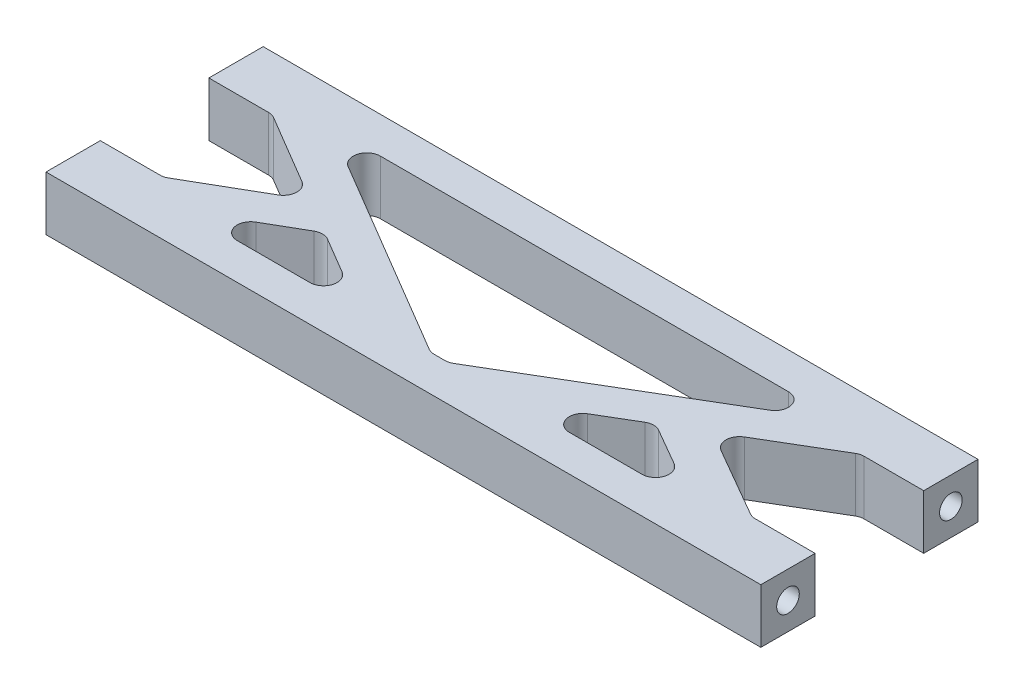
from build123d import *

# Parameters (mm, degrees)
SKETCH1_W                   = 79
SKETCH1_H                   = 24
BOSS_EXTRUDE1_DEPTH         = 6
CUT_EXTRUDE1_REACH          = 84.783
TAP_DRILL_FOR_M3_TAP1_D     = 2.5
TAP_DRILL_FOR_M3_TAP1_DEPTH = 10
TAP_DRILL_FOR_M3_TAP1_TIP   = 0.751075774
TAP_DRILL_FOR_M3_TAP2_D     = 2.5
TAP_DRILL_FOR_M3_TAP2_DEPTH = 10
TAP_DRILL_FOR_M3_TAP2_TIP   = 0.751075774
FILLET1_R                   = 1.5


with BuildPart() as part:
    # Sketch1 → Boss-Extrude1 (new body)
    with BuildSketch(Plane(origin=(0, 0, 0), x_dir=(1, 0, 0), z_dir=(0, 1, 0))):
        with Locations((39.5, 12)):
            Rectangle(SKETCH1_W, SKETCH1_H)
    extrude(amount=BOSS_EXTRUDE1_DEPTH)

    # Sketch2 → Cut-Extrude1 (cut, up to next)
    with BuildSketch(Plane(origin=(0, 6, 0), x_dir=(1, 0, 0), z_dir=(0, 1, 0)), mode=Mode.PRIVATE) as cut_extrude1_sk1:
        Polygon((0, 18), (7, 18), (17.261996282, 11.924766316), (7, 6), (0, 6), align=None)
    cut_extrude1_tool1 = extrude(cut_extrude1_sk1.sketch, amount=-CUT_EXTRUDE1_REACH, mode=Mode.PRIVATE) & part.part
    # Sketch2 → Cut-Extrude1 (cut, up to next)
    with BuildSketch(Plane(origin=(0, 6, 0), x_dir=(1, 0, 0), z_dir=(0, 1, 0)), mode=Mode.PRIVATE) as cut_extrude1_sk2:
        Polygon((11.473559691, 20), (67.526440309, 20), (40.5, 4), (38.5, 4), align=None)
    cut_extrude1_tool2 = extrude(cut_extrude1_sk2.sketch, amount=-CUT_EXTRUDE1_REACH, mode=Mode.PRIVATE) & part.part
    # Sketch2 → Cut-Extrude1 (cut, up to next)
    with BuildSketch(Plane(origin=(0, 6, 0), x_dir=(1, 0, 0), z_dir=(0, 1, 0)), mode=Mode.PRIVATE) as cut_extrude1_sk3:
        Polygon((79, 18), (72, 18), (61.738003718, 11.924766316), (72, 6), (79, 6), align=None)
    cut_extrude1_tool3 = extrude(cut_extrude1_sk3.sketch, amount=-CUT_EXTRUDE1_REACH, mode=Mode.PRIVATE) & part.part
    # Sketch2 → Cut-Extrude1 (cut, up to next)
    with BuildSketch(Plane(origin=(0, 6, 0), x_dir=(1, 0, 0), z_dir=(0, 1, 0)), mode=Mode.PRIVATE) as cut_extrude1_sk4:
        Polygon((21.211840493, 9.586407781), (11.535898385, 4), (30.64813527, 4), align=None)
    cut_extrude1_tool4 = extrude(cut_extrude1_sk4.sketch, amount=-CUT_EXTRUDE1_REACH, mode=Mode.PRIVATE) & part.part
    # Sketch2 → Cut-Extrude1 (cut, up to next)
    with BuildSketch(Plane(origin=(0, 6, 0), x_dir=(1, 0, 0), z_dir=(0, 1, 0)), mode=Mode.PRIVATE) as cut_extrude1_sk5:
        Polygon((48.35186473, 4), (57.788159507, 9.586407781), (67.464101615, 4), align=None)
    cut_extrude1_tool5 = extrude(cut_extrude1_sk5.sketch, amount=-CUT_EXTRUDE1_REACH, mode=Mode.PRIVATE) & part.part
    add(cut_extrude1_tool1.solids().sort_by_distance((6.427205, 6, -11.989393))[0], mode=Mode.SUBTRACT)
    add(cut_extrude1_tool2.solids().sort_by_distance((39.5, 6, -14.482926))[0], mode=Mode.SUBTRACT)
    add(cut_extrude1_tool3.solids().sort_by_distance((72.572795, 6, -11.989393))[0], mode=Mode.SUBTRACT)
    add(cut_extrude1_tool4.solids().sort_by_distance((21.131958, 6, -5.862136))[0], mode=Mode.SUBTRACT)
    add(cut_extrude1_tool5.solids().sort_by_distance((57.868042, 6, -5.862136))[0], mode=Mode.SUBTRACT)

    # Tap Drill for M3 Tap1
    with Locations(Plane.ZY):
        with Locations((-21, 3), (-3, 3)):
            Hole(TAP_DRILL_FOR_M3_TAP1_D / 2, depth=TAP_DRILL_FOR_M3_TAP1_DEPTH)
            with Locations((0, 0, -(TAP_DRILL_FOR_M3_TAP1_DEPTH + TAP_DRILL_FOR_M3_TAP1_TIP / 2))):  # 118° drill point
                Cone(0, TAP_DRILL_FOR_M3_TAP1_D / 2, TAP_DRILL_FOR_M3_TAP1_TIP, mode=Mode.SUBTRACT)

    # Tap Drill for M3 Tap2
    with Locations(Plane(origin=(79, 0, 0), x_dir=(0, 0, -1), z_dir=(1, 0, 0))):
        with Locations((3, 3), (21, 3)):
            Hole(TAP_DRILL_FOR_M3_TAP2_D / 2, depth=TAP_DRILL_FOR_M3_TAP2_DEPTH)
            with Locations((0, 0, -(TAP_DRILL_FOR_M3_TAP2_DEPTH + TAP_DRILL_FOR_M3_TAP2_TIP / 2))):  # 118° drill point
                Cone(0, TAP_DRILL_FOR_M3_TAP2_D / 2, TAP_DRILL_FOR_M3_TAP2_TIP, mode=Mode.SUBTRACT)

    # Fillet1
    fillet1_edges = [part.edges().sort_by_distance(p)[0] for p in [
        (48.35186473, 3, -4),
        (57.788159507, 3, -9.586407781),
        (72, 3, -6),
        (61.738003718, 3, -11.924766316),
        (72, 3, -18),
        (67.526440309, 3, -20),
        (40.5, 3, -4),
        (38.5, 3, -4),
        (11.473559691, 3, -20),
        (30.64813527, 3, -4),
        (21.211840493, 3, -9.586407781),
        (7, 3, -6),
        (17.261996282, 3, -11.924766316),
        (7, 3, -18),
        (67.464101615, 3, -4),
        (11.535898385, 3, -4),
    ]]
    fillet(fillet1_edges, radius=FILLET1_R)


solid = part.part
